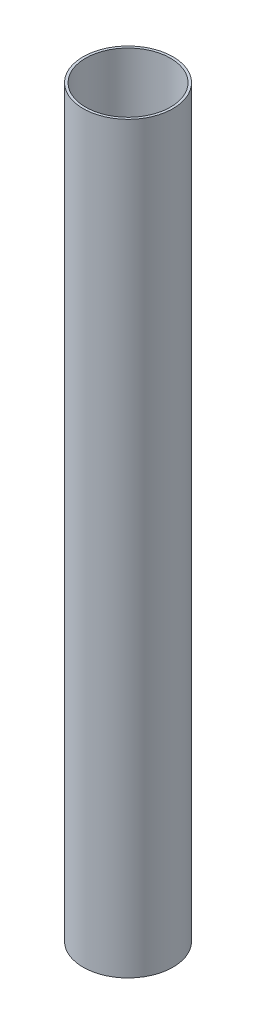
from build123d import *

# Parameters (mm, degrees)
SKETCH1_W = 0.85
SKETCH1_H = 254


with BuildPart() as part:
    # Sketch1 → Revolve2 (revolve)
    with BuildSketch(Plane.XY):
        with Locations((-14.925, 127)):
            Rectangle(SKETCH1_W, SKETCH1_H)
    revolve(axis=Axis((0, 0, 0), (0, 1, 0)))


solid = part.part
